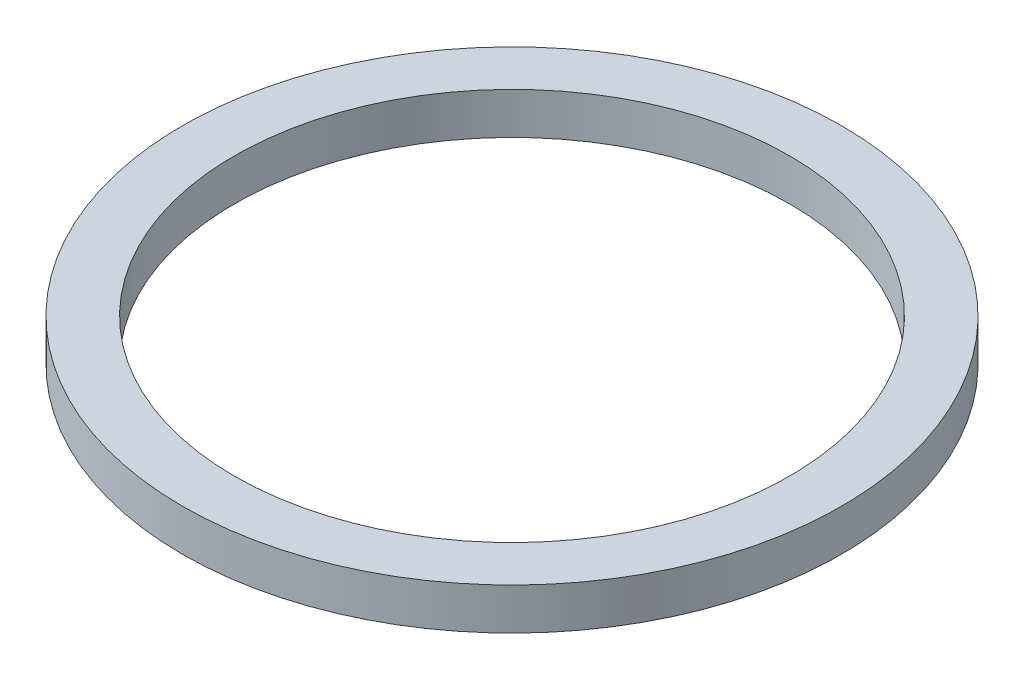
from build123d import *

# Parameters (mm, degrees)
SKETCH1_R           = 47.5
BOSS_EXTRUDE1_DEPTH = 6
SKETCH2_R           = 40
CUT_EXTRUDE1_DEPTH  = 68.44256816


with BuildPart() as part:
    # Sketch1 → Boss-Extrude1 (new body)
    with BuildSketch(Plane(origin=(0, 0, 0), x_dir=(1, 0, 0), z_dir=(0, 1, 0))):
        Circle(SKETCH1_R)
    extrude(amount=BOSS_EXTRUDE1_DEPTH)

    # Sketch2 → Cut-Extrude1 (cut, through all)
    with BuildSketch(Plane(origin=(0, 0, 0), x_dir=(1, 0, 0), z_dir=(0, 1, 0))):
        Circle(SKETCH2_R)
    extrude(amount=CUT_EXTRUDE1_DEPTH, mode=Mode.SUBTRACT)


solid = part.part
